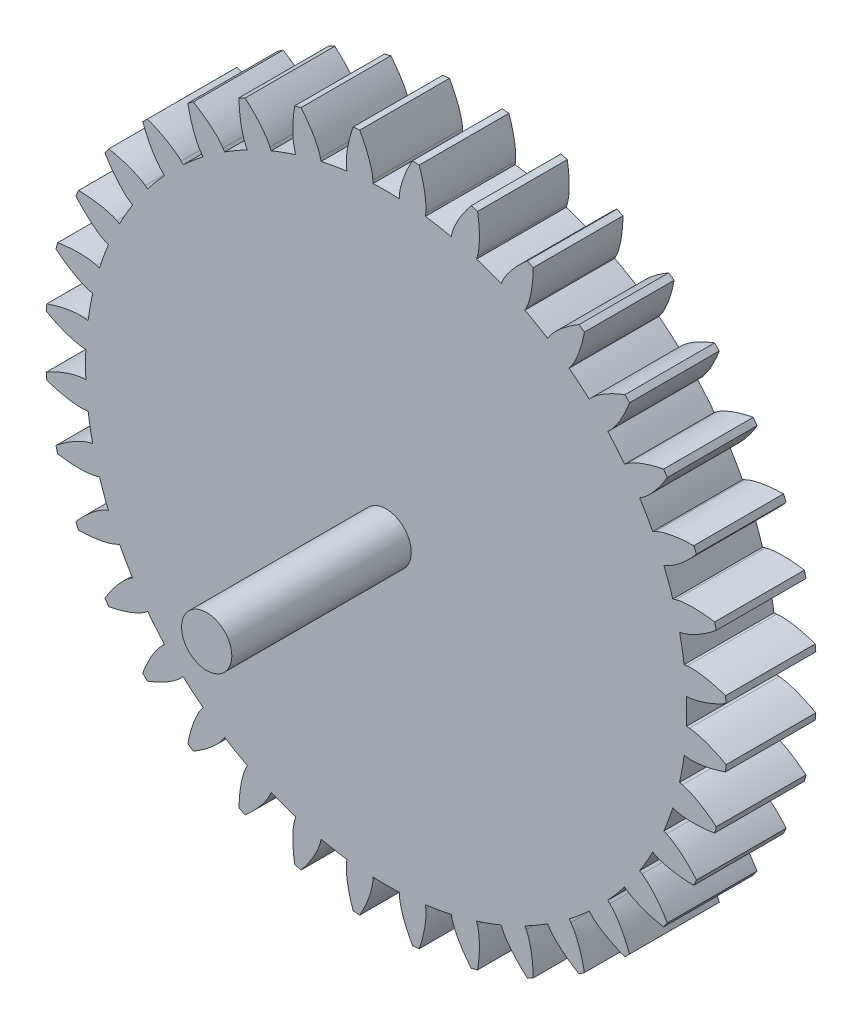
from build123d import *

# Parameters (mm, degrees)
SKETCH_1_R               = 4
SKETCH_1_R_2             = 1.4
EXTRUDE_1_DEPTH          = 5
CUT_EXTRUDE_1_DEPTH      = 8.549834435
PATTERN_CIRCULAR_1_COUNT = 6
PATTERN_CIRCULAR_1_ANGLE = 300
SKETCH_2_R               = 19
SKETCH_2_R_2             = 1.4
EXTRUDE_2_DEPTH          = 5
CUT_EXTRUDE_3_DEPTH      = 28.331300895
PATTERN_CIRCULAR_2_COUNT = 36
SKETCH_3_R               = 1.4
EXTRUDE_3_DEPTH          = 10
EXTRUDE_START            = -15
SKETCH_3_2_R             = 1.4
EXTRUDE_4_DEPTH          = 15


with BuildPart() as part:
    # 草图1 → 凸台-拉伸1 (new body)
    with BuildSketch(Plane.XY):
        Circle(SKETCH_1_R)
        Circle(SKETCH_1_R_2, mode=Mode.SUBTRACT)
    extrude(amount=EXTRUDE_1_DEPTH)

    # 草图1<3> → 切除-拉伸1 (cut, through all)
    with BuildSketch(Plane.XY):
        with BuildLine():
            Line((2.730540893, 0.700961074), (1.695038873, 0.435135863))
            ThreePointArc((1.695038873, 0.435135863), (1.736205349, 0.219296571), (1.75, 0))
            ThreePointArc((1.75, 0), (1.736205349, -0.219296571), (1.695038873, -0.435135863))
            Line((1.695038873, -0.435135863), (2.730540893, -0.700961074))
            add(Edge.make_bspline(
                [(2.730540893, -0.700961074), (2.751355068, -0.706304311), (2.808329953, -0.725541446), (2.910522768, -0.778982289), (3.06267796, -0.887491262), (3.235956594, -1.057334282), (3.408810129, -1.2831446), (3.52264255, -1.482702951), (3.589508983, -1.625182096), (3.620975996, -1.699568426)],
                knots=[0, 0, 0, 0, 0, 0.005604068, 0.015718248, 0.029959916, 0.048733667, 0.068727063, 0.089838728, 0.089838728, 0.089838728, 0.089838728, 0.089838728], degree=4))
            ThreePointArc((3.620975996, -1.699568426), (3.90409426, -0.870659525), (4, 0))
            ThreePointArc((4, 0), (3.90409426, 0.870659525), (3.620975996, 1.699568426))
            add(Edge.make_bspline(
                [(2.730540893, 0.700961074), (2.751355068, 0.706304311), (2.808329953, 0.725541446), (2.910522768, 0.778982289), (3.06267796, 0.887491262), (3.235956594, 1.057334282), (3.408810129, 1.2831446), (3.52264255, 1.482702951), (3.589508983, 1.625182096), (3.620975996, 1.699568426)],
                knots=[0, 0, 0, 0, 0, 0.005604068, 0.015718248, 0.029959916, 0.048733667, 0.068727063, 0.089838728, 0.089838728, 0.089838728, 0.089838728, 0.089838728], degree=4))
        make_face()
    cut_extrude_1 = extrude(amount=CUT_EXTRUDE_1_DEPTH, mode=Mode.SUBTRACT)

    # 阵列(圆周)1: 切除-拉伸1 ×6 about axis
    pattern_circular_1_axis = Axis((0, 0, 5), (0, 0, 1))
    for i in range(1, PATTERN_CIRCULAR_1_COUNT):
        add(cut_extrude_1.rotate(pattern_circular_1_axis, i * PATTERN_CIRCULAR_1_ANGLE / (PATTERN_CIRCULAR_1_COUNT - 1)), mode=Mode.SUBTRACT)

    # 草图2 → 凸台-拉伸2 (add)
    with BuildSketch(Plane.XY.offset(5)):
        Circle(SKETCH_2_R)
        Circle(SKETCH_2_R_2, mode=Mode.SUBTRACT)
    extrude(amount=EXTRUDE_2_DEPTH)

    # 草图2<3> → 切除-拉伸3 (cut, through all)
    with BuildSketch(Plane.XY.offset(5)):
        with BuildLine():
            Line((16.898368349, 0.737798696), (16.734057711, 0.730624738))
            ThreePointArc((16.734057711, 0.730624738), (16.746013954, 0.365399324), (16.75, 0))
            ThreePointArc((16.75, 0), (16.746013954, -0.365399324), (16.734057711, -0.730624738))
            Line((16.734057711, -0.730624738), (16.898368349, -0.737798696))
            add(Edge.make_bspline(
                [(16.898368349, -0.737798696), (16.930520186, -0.739202475), (16.994649698, -0.743982377), (17.122212474, -0.761309932), (17.362329834, -0.809387379), (17.679190815, -0.897926373), (18.133290234, -1.063263223), (18.513224691, -1.23958218), (18.780722015, -1.380744056), (18.942863834, -1.472382346)],
                knots=[0, 0, 0, 0, 0, 0.001401017, 0.002802034, 0.005604068, 0.010661158, 0.015718248, 0.023831652, 0.023831652, 0.023831652, 0.023831652, 0.023831652], degree=4))
            ThreePointArc((18.942863834, -1.472382346), (18.985710585, -0.73674526), (19, 0))
            ThreePointArc((19, 0), (18.985710585, 0.73674526), (18.942863834, 1.472382346))
            add(Edge.make_bspline(
                [(16.898368349, 0.737798696), (16.930520186, 0.739202475), (16.994649698, 0.743982377), (17.122212474, 0.761309932), (17.362329834, 0.809387379), (17.679190815, 0.897926373), (18.133290234, 1.063263223), (18.513224691, 1.23958218), (18.780722015, 1.380744056), (18.942863834, 1.472382346)],
                knots=[0, 0, 0, 0, 0, 0.001401017, 0.002802034, 0.005604068, 0.010661158, 0.015718248, 0.023831652, 0.023831652, 0.023831652, 0.023831652, 0.023831652], degree=4))
        make_face()
    cut_extrude_3 = extrude(amount=CUT_EXTRUDE_3_DEPTH, mode=Mode.SUBTRACT)

    # 阵列(圆周)2: 切除-拉伸3 ×36 about axis
    pattern_circular_2_axis = Axis((0, 0, 10), (0, 0, 1))
    for i in range(1, PATTERN_CIRCULAR_2_COUNT):
        add(cut_extrude_3.rotate(pattern_circular_2_axis, i * 360 / PATTERN_CIRCULAR_2_COUNT), mode=Mode.SUBTRACT)



with BuildPart() as body_2:
    # 草图3 → 凸台-拉伸3 (new body)
    with BuildSketch(Plane.XY.offset(10)):
        Circle(SKETCH_3_R)
    extrude(amount=EXTRUDE_3_DEPTH)


with BuildPart() as part_1:
    add(part.part)

    add(body_2.part)  # 凸台-拉伸4 merges body 2
    # 草图3<2> → 凸台-拉伸4 (add)
    with BuildSketch(Plane.XY.offset(10).offset(EXTRUDE_START)):
        Circle(SKETCH_3_2_R)
    extrude(amount=EXTRUDE_4_DEPTH)


solid = part_1.part
